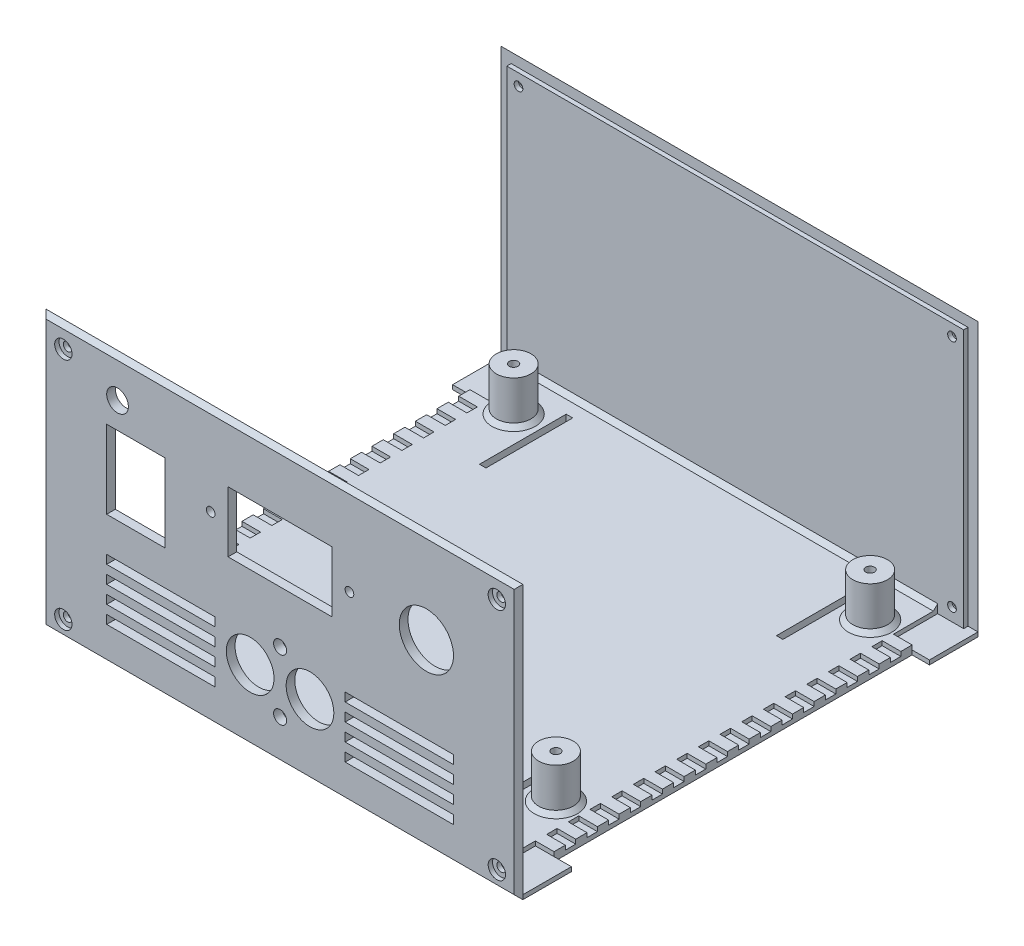
from build123d import *

# Parameters (mm, degrees)
SKETCH1_W                = 110
SKETCH1_H                = 64
BOSS_EXTRUDE1_DEPTH      = 94
SKETCH2_W                = 90
SKETCH2_H                = 62
CUT_EXTRUDE1_DEPTH       = 110
SKETCH3_W                = 105.4
SKETCH3_H                = 59.7
BOSS_EXTRUDE2_DEPTH      = 1
SKETCH4_W                = 105.4
SKETCH4_H                = 59.7
BOSS_EXTRUDE3_DEPTH      = 1
SKETCH5_W                = 110
SKETCH5_H                = 1
CUT_EXTRUDE6_DEPTH       = 101
BOSS_EXTRUDE4_DEPTH      = 1
SKETCH7_W                = 92
SKETCH7_H                = 1
CUT_EXTRUDE7_DEPTH       = 121
SKETCH8_W                = 4
SKETCH8_H                = 67.6
CUT_EXTRUDE8_DEPTH       = 1
SKETCH13_W               = 25
SKETCH13_H               = 2
CUT_EXTRUDE13_DEPTH      = 2
SKETCH17_W               = 110
SKETCH17_H               = 2
BOSS_EXTRUDE5_DEPTH      = 15
SKETCH19_W               = 110
SKETCH19_H               = 2
BOSS_EXTRUDE6_DEPTH      = 61
SKETCH20_W               = 2.3
SKETCH20_H               = 1
CUT_EXTRUDE15_DEPTH      = 62
SKETCH21_W               = 105.4
SKETCH21_H               = 1
CUT_EXTRUDE16_DEPTH      = 2.3
SKETCH22_W               = 8.3
SKETCH22_H               = 10.2
CUT_EXTRUDE17_DEPTH      = 1
SKETCH24_R               = 2
CUT_EXTRUDE18_DEPTH      = 1
CUT_EXTRUDE19_DEPTH      = 71
CUT_EXTRUDE19_DEPTH_BACK = 11
SKETCH26_W               = 4
SKETCH26_H               = 12.4
CUT_EXTRUDE20_DEPTH      = 2
SKETCH29_W               = 4
SKETCH29_H               = 2.6
SKETCH29_W_2             = 4.3
SKETCH29_H_2             = 2.2
CUT_EXTRUDE21_DEPTH      = 2
SKETCH31_W               = 4.3
SKETCH31_H               = 7.8
SKETCH31_H_2             = 7.6
BOSS_EXTRUDE7_DEPTH      = 1
SKETCH32_W               = 4
SKETCH32_H               = 2.6
CUT_EXTRUDE22_DEPTH      = 11
SKETCH33_W               = 4.3
SKETCH33_H               = 2.4
SKETCH33_W_2             = 4.379496006
CUT_EXTRUDE24_DEPTH      = 1
SKETCH34_W               = 4.3
SKETCH34_H               = 2.188552273
BOSS_EXTRUDE8_DEPTH      = 1
SKETCH35_R               = 4
BOSS_EXTRUDE9_DEPTH      = 10
CUT_EXTRUDE25_START      = -1
SKETCH11_R               = 2
CUT_EXTRUDE25_DEPTH      = 1
SKETCH37_R               = 1
CUT_EXTRUDE26_DEPTH      = 5
SKETCH38_W               = 1.5
SKETCH38_H               = 20
CUT_EXTRUDE27_DEPTH      = 5
SKETCH39_R               = 1
CUT_EXTRUDE28_DEPTH      = 145
CHAMFER1_SIZE            = 1
CHAMFER2_SIZE            = 1
SKETCH41_W               = 25
SKETCH41_H               = 2
BOSS_EXTRUDE10_DEPTH     = 2
SKETCH14_R               = 6.25
SKETCH14_R_2             = 2.5
SKETCH14_R_3             = 5.5
SKETCH14_R_4             = 1.5
SKETCH14_R_5             = 1
SKETCH14_W               = 13.5
SKETCH14_H               = 18
SKETCH14_W_2             = 24
SKETCH14_H_2             = 14
CUT_EXTRUDE29_DEPTH      = 2
CUT_EXTRUDE30_DEPTH      = 1
SKETCH43_W               = 4.463070592
SKETCH43_H               = 0.966464222
BOSS_EXTRUDE11_DEPTH     = 1


with BuildPart() as part:
    # Sketch1 → Boss-Extrude1 (new body)
    with BuildSketch(Plane.XY):
        with Locations((55, 32)):
            Rectangle(SKETCH1_W, SKETCH1_H)
    extrude(amount=-BOSS_EXTRUDE1_DEPTH)

    # Sketch2 → Cut-Extrude1 (cut)
    with BuildSketch(Plane(origin=(110, 0, 0), x_dir=(0, 0, -1), z_dir=(1, 0, 0))):
        with Locations((47, 33)):
            Rectangle(SKETCH2_W, SKETCH2_H)
    extrude(amount=-CUT_EXTRUDE1_DEPTH, mode=Mode.SUBTRACT)

    # Sketch3 → Boss-Extrude2 (add)
    with BuildSketch(Plane(origin=(0, 0, -2), x_dir=(-1, 0, 0), z_dir=(0, 0, -1))):
        with Locations((-55, 31.85)):
            Rectangle(SKETCH3_W, SKETCH3_H)
    extrude(amount=BOSS_EXTRUDE2_DEPTH)

    # Sketch4 → Boss-Extrude3 (add)
    with BuildSketch(Plane.XY.offset(-92)):
        with Locations((55, 31.85)):
            Rectangle(SKETCH4_W, SKETCH4_H)
    extrude(amount=BOSS_EXTRUDE3_DEPTH)

    # Sketch5 → Cut-Extrude6 (cut)
    with BuildSketch(Plane(origin=(0, 64, 0), x_dir=(1, 0, 0), z_dir=(0, 1, 0))):
        with Locations((55, 93.5)):
            Rectangle(SKETCH5_W, SKETCH5_H)
        with Locations((55, 0.5)):
            Rectangle(SKETCH5_W, SKETCH5_H)
    extrude(amount=-CUT_EXTRUDE6_DEPTH, mode=Mode.SUBTRACT)

    # Sketch6 → Boss-Extrude4 (add)
    with BuildSketch(Plane(origin=(0, 2, 0), x_dir=(1, 0, 0), z_dir=(0, 1, 0))):
        Polygon((4, 20.8), (4, 18.2), (8.3, 18.2), (8.3, 15.8), (4, 15.8), (4, 13.2), (8.3, 13.2), (8.3, 3), (101.7, 3), (101.7, 13.2), (106, 13.2), (106, 15.8), (101.7, 15.8), (101.7, 18.2), (106, 18.2), (106, 20.8), (101.7, 20.8), (101.7, 23.2), (106, 23.2), (106, 25.8), (101.7, 25.8), (101.7, 28.2), (106, 28.2), (106, 30.8), (101.7, 30.8), (101.7, 33.2), (106, 33.2), (106, 35.8), (101.7, 35.8), (101.7, 38.2), (106, 38.2), (106, 40.8), (101.7, 40.8), (101.7, 43.2), (106, 43.2), (106, 45.8), (101.7, 45.8), (101.7, 48.2), (106, 48.2), (106, 50.8), (101.7, 50.8), (101.7, 53.2), (106, 53.2), (106, 55.8), (101.7, 55.8), (101.7, 58.2), (106, 58.2), (106, 60.8), (101.7, 60.8), (101.7, 63.2), (106, 63.2), (106, 65.8), (101.7, 65.8), (101.7, 68.2), (106, 68.2), (106, 70.8), (101.7, 70.8), (101.7, 73.2), (106, 73.2), (106, 75.8), (101.7, 75.8), (101.7, 78.2), (106, 78.2), (106, 80.8), (101.7, 80.8), (101.7, 91), (8.3, 91), (8.3, 80.8), (4, 80.8), (4, 78.2), (8.3, 78.2), (8.3, 75.8), (4, 75.8), (4, 73.2), (8.3, 73.2), (8.3, 70.8), (4, 70.8), (4, 68.2), (8.3, 68.2), (8.3, 65.8), (4, 65.8), (4, 63.2), (8.3, 63.2), (8.3, 60.8), (4, 60.8), (4, 58.2), (8.3, 58.2), (8.3, 55.8), (4, 55.8), (4, 53.2), (8.3, 53.2), (8.3, 50.8), (4, 50.8), (4, 48.2), (8.3, 48.2), (8.3, 45.8), (4, 45.8), (4, 43.2), (8.3, 43.2), (8.3, 40.8), (4, 40.8), (4, 38.2), (8.3, 38.2), (8.3, 35.8), (4, 35.8), (4, 33.2), (8.3, 33.2), (8.3, 30.8), (4, 30.8), (4, 28.2), (8.3, 28.2), (8.3, 25.8), (4, 25.8), (4, 23.2), (8.3, 23.2), (8.3, 20.8), align=None)
    extrude(amount=BOSS_EXTRUDE4_DEPTH)

    # Sketch7 → Cut-Extrude7 (cut)
    with BuildSketch(Plane.ZY):
        with Locations((-47, 0.5)):
            Rectangle(SKETCH7_W, SKETCH7_H)
    extrude(amount=-CUT_EXTRUDE7_DEPTH, mode=Mode.SUBTRACT)

    # Sketch8 → Cut-Extrude8 (cut)
    with BuildSketch(Plane(origin=(0, 2, 0), x_dir=(1, 0, 0), z_dir=(0, 1, 0))):
        with Locations((108, 47)):
            Rectangle(SKETCH8_W, SKETCH8_H)
        with Locations((2, 47)):
            Rectangle(SKETCH8_W, SKETCH8_H)
    extrude(amount=-CUT_EXTRUDE8_DEPTH, mode=Mode.SUBTRACT)

    # Sketch13 → Cut-Extrude13 (cut)
    with BuildSketch(Plane.XY.offset(-1)):
        with Locations((27.5, 22)):
            Rectangle(SKETCH13_W, SKETCH13_H)
        with Locations((27.5, 26)):
            Rectangle(SKETCH13_W, SKETCH13_H)
        with Locations((27.5, 18)):
            Rectangle(SKETCH13_W, SKETCH13_H)
        with Locations((27.5, 14)):
            Rectangle(SKETCH13_W, SKETCH13_H)
        with Locations((27.5, 10)):
            Rectangle(SKETCH13_W, SKETCH13_H)
        with Locations((82.5, 26)):
            Rectangle(SKETCH13_W, SKETCH13_H)
        with Locations((82.5, 22)):
            Rectangle(SKETCH13_W, SKETCH13_H)
        with Locations((82.5, 18)):
            Rectangle(SKETCH13_W, SKETCH13_H)
        with Locations((82.5, 14)):
            Rectangle(SKETCH13_W, SKETCH13_H)
        with Locations((82.5, 10)):
            Rectangle(SKETCH13_W, SKETCH13_H)
    extrude(amount=-CUT_EXTRUDE13_DEPTH, mode=Mode.SUBTRACT)

    # Sketch17 → Boss-Extrude5 (add)
    with BuildSketch(Plane(origin=(0, 0, -93), x_dir=(-1, 0, 0), z_dir=(0, 0, -1))):
        with Locations((-55, 2)):
            Rectangle(SKETCH17_W, SKETCH17_H)
    extrude(amount=BOSS_EXTRUDE5_DEPTH)

    # Sketch19 → Boss-Extrude6 (add)
    with BuildSketch(Plane(origin=(0, 3, 0), x_dir=(1, 0, 0), z_dir=(0, 1, 0))):
        with Locations((55, 107)):
            Rectangle(SKETCH19_W, SKETCH19_H)
    extrude(amount=BOSS_EXTRUDE6_DEPTH)

    # Sketch20 → Cut-Extrude15 (cut)
    with BuildSketch(Plane(origin=(0, 64, 0), x_dir=(1, 0, 0), z_dir=(0, 1, 0))):
        with Locations((1.15, 106.5)):
            Rectangle(SKETCH20_W, SKETCH20_H)
        with Locations((108.85, 106.5)):
            Rectangle(SKETCH20_W, SKETCH20_H)
    extrude(amount=-CUT_EXTRUDE15_DEPTH, mode=Mode.SUBTRACT)

    # Sketch21 → Cut-Extrude16 (cut)
    with BuildSketch(Plane(origin=(0, 64, 0), x_dir=(1, 0, 0), z_dir=(0, 1, 0))):
        with Locations((55, 106.5)):
            Rectangle(SKETCH21_W, SKETCH21_H)
    extrude(amount=-CUT_EXTRUDE16_DEPTH, mode=Mode.SUBTRACT)

    # Sketch22 → Cut-Extrude17 (cut)
    with BuildSketch(Plane(origin=(0, 3, 0), x_dir=(1, 0, 0), z_dir=(0, 1, 0))):
        with Locations((4.15, 100.9)):
            Rectangle(SKETCH22_W, SKETCH22_H)
        with Locations((105.85, 100.9)):
            Rectangle(SKETCH22_W, SKETCH22_H)
    extrude(amount=-CUT_EXTRUDE17_DEPTH, mode=Mode.SUBTRACT)

    # Sketch24 → Cut-Extrude18 (cut)
    with BuildSketch(Plane(origin=(0, 0, -108), x_dir=(-1, 0, 0), z_dir=(0, 0, -1))):
        with Locations((-105, 59)):
            Circle(SKETCH24_R)
        with Locations((-5, 59)):
            Circle(SKETCH24_R)
        with Locations((-105, 5)):
            Circle(SKETCH24_R)
        with Locations((-5, 5)):
            Circle(SKETCH24_R)
    extrude(amount=-CUT_EXTRUDE18_DEPTH, mode=Mode.SUBTRACT)

    # Sketch26 → Cut-Extrude19 (cut, two sides: drawn at the far end of the back side and taken through both)
    with BuildSketch(Plane(origin=(0, 3, 0), x_dir=(1, 0, 0), z_dir=(0, 1, 0)).offset(-CUT_EXTRUDE19_DEPTH_BACK)):
        with Locations((2, 87)):
            Rectangle(SKETCH26_W, SKETCH26_H)
        with Locations((108, 87)):
            Rectangle(SKETCH26_W, SKETCH26_H)
    extrude(amount=CUT_EXTRUDE19_DEPTH + CUT_EXTRUDE19_DEPTH_BACK, mode=Mode.SUBTRACT)

    # Sketch27 → Cut-Extrude20 (cut)
    with BuildSketch(Plane.XY.offset(-91)):
        Polygon((8.3, 3), (10.129407604, 3), (101.7, 3), (106, 3), (106, 61.7), (4, 61.7), (4, 3), align=None)
        Polygon((106, 61.7), (106, 3), (110, 3), (110, 64), (4, 64), (4, 61.7), align=None)
    extrude(amount=-CUT_EXTRUDE20_DEPTH, mode=Mode.SUBTRACT)

    # Sketch29 → Cut-Extrude21 (cut)
    with BuildSketch(Plane(origin=(0, 3, 0), x_dir=(1, 0, 0), z_dir=(0, 1, 0))):
        with Locations((2, 94.5)):
            Rectangle(SKETCH29_W, SKETCH29_H)
        with Locations((103.85, 92.1)):
            Rectangle(SKETCH29_W_2, SKETCH29_H_2)
    extrude(amount=-CUT_EXTRUDE21_DEPTH, mode=Mode.SUBTRACT)

    # Sketch31 → Boss-Extrude7 (add)
    with BuildSketch(Plane(origin=(0, 3, 0), x_dir=(1, 0, 0), z_dir=(0, 1, 0))):
        with Locations((6.15, 87.1)):
            Rectangle(SKETCH31_W, SKETCH31_H)
        with Locations((103.85, 87)):
            Rectangle(SKETCH31_W, SKETCH31_H_2)
    extrude(amount=-BOSS_EXTRUDE7_DEPTH)

    # Sketch32 → Cut-Extrude22 (cut)
    with BuildSketch(Plane(origin=(0, 3, 0), x_dir=(1, 0, 0), z_dir=(0, 1, 0))):
        with Locations((108, 94.5)):
            Rectangle(SKETCH32_W, SKETCH32_H)
    extrude(amount=-CUT_EXTRUDE22_DEPTH, mode=Mode.SUBTRACT)

    # Sketch33 → Cut-Extrude24 (cut)
    with BuildSketch(Plane(origin=(0, 3, 0), x_dir=(1, 0, 0), z_dir=(0, 1, 0))):
        with Locations((6.15, 87)):
            Rectangle(SKETCH33_W, SKETCH33_H)
        with Locations((6.110251997, 92)):
            Rectangle(SKETCH33_W_2, SKETCH33_H)
        with Locations((103.85, 87)):
            Rectangle(SKETCH33_W, SKETCH33_H)
    extrude(amount=-CUT_EXTRUDE24_DEPTH, mode=Mode.SUBTRACT)

    # Sketch34 → Boss-Extrude8 (add)
    with BuildSketch(Plane(origin=(0, 2, 0), x_dir=(1, 0, 0), z_dir=(0, 1, 0))):
        with Locations((103.85, 92.094276136)):
            Rectangle(SKETCH34_W, SKETCH34_H)
    extrude(amount=-BOSS_EXTRUDE8_DEPTH)

    # Sketch35 → Boss-Extrude9 (add)
    with BuildSketch(Plane(origin=(0, 3, 0), x_dir=(1, 0, 0), z_dir=(0, 1, 0))):
        with Locations(Location((13.8775, 96, 0), (0, 0, 270))):
            Circle(SKETCH35_R)
        with Locations(Location((96.1225, 96, 0), (0, 0, 270))):
            Circle(SKETCH35_R)
        with Locations(Location((96.1225, 23.508, 0), (0, 0, 270))):
            Circle(SKETCH35_R)
        with Locations(Location((13.8775, 23.508, 0), (0, 0, 270))):
            Circle(SKETCH35_R)
    extrude(amount=BOSS_EXTRUDE9_DEPTH)

    # Sketch11 → Cut-Extrude25 (cut)
    with BuildSketch(Plane.XY.offset(-1).offset(CUT_EXTRUDE25_START)):
        with Locations(Location((5, 59, 0), (0, 0, 180))):
            Circle(SKETCH11_R)
        with Locations(Location((105, 59, 0), (0, 0, 180))):
            Circle(SKETCH11_R)
        with Locations(Location((105, 5, 0), (0, 0, 180))):
            Circle(SKETCH11_R)
        with Locations(Location((5, 5, 0), (0, 0, 180))):
            Circle(SKETCH11_R)
    extrude(amount=CUT_EXTRUDE25_DEPTH, mode=Mode.SUBTRACT)

    # Sketch37 → Cut-Extrude26 (cut)
    with BuildSketch(Plane(origin=(0, 13, 0), x_dir=(1, 0, 0), z_dir=(0, 1, 0))):
        with Locations(Location((96.1225, 23.508, 0), (0, 0, 270))):
            Circle(SKETCH37_R)
        with Locations(Location((13.8775, 23.508, 0), (0, 0, 270))):
            Circle(SKETCH37_R)
        with Locations(Location((96.1225, 96, 0), (0, 0, 270))):
            Circle(SKETCH37_R)
        with Locations(Location((13.8775, 96, 0), (0, 0, 270))):
            Circle(SKETCH37_R)
    extrude(amount=-CUT_EXTRUDE26_DEPTH, mode=Mode.SUBTRACT)

    # Sketch38 → Cut-Extrude27 (cut)
    with BuildSketch(Plane.XZ.offset(-1)):
        with Locations((20.75, -92)):
            Rectangle(SKETCH38_W, SKETCH38_H)
        with Locations((20.75, -17)):
            Rectangle(SKETCH38_W, SKETCH38_H)
        with Locations((89.25, -17)):
            Rectangle(SKETCH38_W, SKETCH38_H)
        with Locations((89.25, -92)):
            Rectangle(SKETCH38_W, SKETCH38_H)
    extrude(amount=-CUT_EXTRUDE27_DEPTH, mode=Mode.SUBTRACT)

    # Sketch39 → Cut-Extrude28 (cut)
    with BuildSketch(Plane.XY.offset(-2)):
        with Locations(Location((105, 5, 0), (0, 0, 180))):
            Circle(SKETCH39_R)
        with Locations(Location((105, 59, 0), (0, 0, 180))):
            Circle(SKETCH39_R)
        with Locations(Location((5, 5, 0), (0, 0, 180))):
            Circle(SKETCH39_R)
        with Locations(Location((5, 59, 0), (0, 0, 180))):
            Circle(SKETCH39_R)
    extrude(amount=-CUT_EXTRUDE28_DEPTH, mode=Mode.SUBTRACT)

    # Chamfer1
    chamfer1_edges = [part.edges().sort_by_distance(p)[0] for p in [
        (96.1225, 3, -100),
        (13.8775, 3, -100),
        (13.8775, 3, -27.508),
        (96.1225, 3, -27.508),
        (55, 3, -3),
        (55, 1, -1),
        (55, 1, -108),
        (55, 3, -106),
    ]]
    chamfer(chamfer1_edges, length=CHAMFER1_SIZE)

    # Chamfer2
    chamfer2_edges = [part.edges().sort_by_distance(p)[0] for p in [
        (0, 33, -108),
        (55, 64, -108),
        (110, 33, -108),
        (110, 33, -1),
        (55, 64, -1),
        (0, 33, -1),
    ]]
    chamfer(chamfer2_edges, length=CHAMFER2_SIZE - 0.0001)  # a hair under: the kernel refuses the full size

    # Sketch41 → Boss-Extrude10 (add)
    with BuildSketch(Plane.XY.offset(-1)):
        with Locations((27.5, 26)):
            Rectangle(SKETCH41_W, SKETCH41_H)
        with Locations((82.5, 26)):
            Rectangle(SKETCH41_W, SKETCH41_H)
    extrude(amount=-BOSS_EXTRUDE10_DEPTH)

    # Sketch14 → Cut-Extrude29 (cut)
    with BuildSketch(Plane.XY.offset(-1)):
        with Locations((88.75, 42.75)):
            Circle(SKETCH14_R)
        with Locations((17.5, 55)):
            Circle(SKETCH14_R_2)
        with Locations((48.1, 17.500243333)):
            Circle(SKETCH14_R_3)
        with Locations((61.9, 17.500243333)):
            Circle(SKETCH14_R_3)
        with Locations((55, 24.500486667)):
            Circle(SKETCH14_R_4)
        with Locations((55, 10.5)):
            Circle(SKETCH14_R_4)
        with Locations((39, 43.5)):
            Circle(SKETCH14_R_5)
        with Locations((71, 43.5)):
            Circle(SKETCH14_R_5)
        with Locations((21.75, 40)):
            Rectangle(SKETCH14_W, SKETCH14_H)
        with Locations((55, 43.5)):
            Rectangle(SKETCH14_W_2, SKETCH14_H_2)
    extrude(amount=-CUT_EXTRUDE29_DEPTH, mode=Mode.SUBTRACT)

    # Sketch42 → Cut-Extrude30 (cut)
    with BuildSketch(Plane(origin=(0, 0, -108), x_dir=(-1, 0, 0), z_dir=(0, 0, -1))):
        Polygon((-16.777839912, 20.498638709), (-16.777839912, 11.292574747), (-35.915954007, 11.292574747), (-35.915954007, 28.10517211), (-16.03222096, 28.10517211), (-18.170575944, 25.616393664), (-30.801250993, 25.616393664), (-30.801250993, 13.781353193), (-21.796492165, 13.781353193), (-21.796492165, 20.498638709), align=None)
        Polygon((-11.189710699, 25.893266741), (-15.109343702, 28.077390581), (-6.188226461, 28.077390581), (-6.188226461, 14.135412356), (-11.189710699, 9.312292497), align=None)
    extrude(amount=-CUT_EXTRUDE30_DEPTH, mode=Mode.SUBTRACT)

    # Sketch43 → Boss-Extrude11 (add)
    with BuildSketch(Plane.XZ.offset(-1)):
        with Locations((103.768464704, -93.184828855)):
            Rectangle(SKETCH43_W, SKETCH43_H)
    extrude(amount=-BOSS_EXTRUDE11_DEPTH)


solid = part.part
